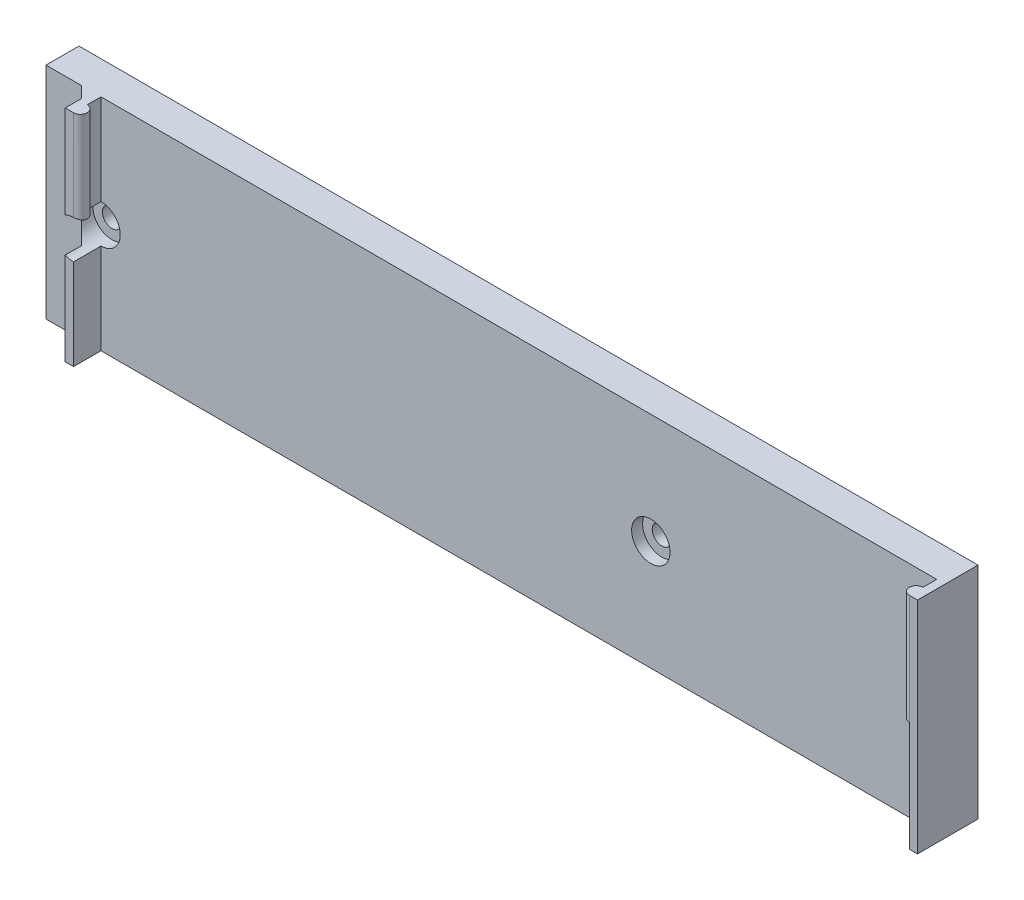
from build123d import *

# Parameters (mm, degrees)
SCHIZZO1_W                   = 155
SCHIZZO1_H                   = 70
ESTRUSIONE_ESTRUSIONE1_DEPTH = 6
ESTRUSIONE_ESTRUSIONE3_DEPTH = 5
ESTRUSIONE_ESTRUSIONE4_DEPTH = 20
SCHIZZO6_W                   = 8.5
SCHIZZO6_H                   = 70
ESTRUSIONE_ESTRUSIONE5_DEPTH = 6
SCHIZZO7_R                   = 1.75
TAGLIO_ESTRUSIONE2_DEPTH     = 94.498663092
FORO1_AT_2_COUNT             = 2
FORO1_AT_2_PITCH             = 100
SCHIZZO9_R                   = 3.5
TAGLIO_ESTRUSIONE3_DEPTH     = 94.112834821
SMUSSO1_SIZE                 = 2
TAGLIO_ESTRUSIONE4_DEPTH     = 30


with BuildPart() as part:
    # Schizzo1 → Estrusione-Estrusione1 (new body)
    with BuildSketch(Plane.XY):
        Rectangle(SCHIZZO1_W, SCHIZZO1_H)
    extrude(amount=ESTRUSIONE_ESTRUSIONE1_DEPTH)

    # Schizzo3 → Estrusione-Estrusione3 (add)
    with BuildSketch(Plane.XY.offset(6)):
        Polygon((-76, -33.5), (-76, 35), (-77.5, 35), (-77.5, -35), (-76, -35), align=None)
        Polygon((77.5, 35), (76, 35), (76, -33.5), (76, -35), (77.5, -35), align=None)
    extrude(amount=ESTRUSIONE_ESTRUSIONE3_DEPTH)

    # Schizzo4 → Estrusione-Estrusione4 (add)
    with BuildSketch(Plane(origin=(0, 35, 0), x_dir=(1, 0, 0), z_dir=(0, 1, 0))):
        with BuildLine():
            ThreePointArc((76, -8.5), (74.75, -9.75), (76, -11))
            Line((76, -11), (76, -8.5))
        make_face()
    estrusione_estrusione4 = extrude(amount=-ESTRUSIONE_ESTRUSIONE4_DEPTH)

    # Specchia1: Estrusione-Estrusione4 across plane
    add(estrusione_estrusione4.mirror(Plane(origin=(0, 0, 0), x_dir=(0, 0, 1), z_dir=(1, 0, 0))))

    # Schizzo6 → Estrusione-Estrusione5 (add)
    with BuildSketch(Plane.XY):
        with Locations((-81.75, 0)):
            Rectangle(SCHIZZO6_W, SCHIZZO6_H)
    extrude(amount=ESTRUSIONE_ESTRUSIONE5_DEPTH)

    # Schizzo7 → Taglio-Estrusione2 (cut, through all)
    with BuildSketch(Plane(origin=(0, 0, 0), x_dir=(-1, 0, 0), z_dir=(0, 0, -1))):
        with Locations((-24, 15)):
            Circle(SCHIZZO7_R)
        with Locations((76, 15)):
            Circle(SCHIZZO7_R)
    extrude(amount=-TAGLIO_ESTRUSIONE2_DEPTH, mode=Mode.SUBTRACT)

    # Schizzo8 → Foro1 (revolve, cut)
    with BuildSketch(Plane(origin=(24, 15, 6), x_dir=(0, -1, 0), z_dir=(1, 0, 0))):
        Polygon((0, 0), (0, 7.051506083), (1.75, 6), (1.75, 2), (3.5, 2), (3.5, 0), align=None)
    foro1 = revolve(axis=Axis((24, 15, 17.310875039), (0, 0, -1)), mode=Mode.SUBTRACT)

    # Foro1 at 2: Foro1 ×2
    with Locations(*[(-i * FORO1_AT_2_PITCH, 0, 0) for i in range(1, FORO1_AT_2_COUNT)]):
        add(foro1, mode=Mode.SUBTRACT)

    # Schizzo9 → Taglio-Estrusione3 (cut, through all)
    with BuildSketch(Plane.XY.offset(4)):
        with Locations((-76, 15)):
            Circle(SCHIZZO9_R)
    extrude(amount=TAGLIO_ESTRUSIONE3_DEPTH, mode=Mode.SUBTRACT)

    # Smusso1
    # the kernel refuses this chamfer: 2 mm, written as the material it adds along each edge
    with BuildSketch(Plane(origin=(-77.5, 13.018911684, 6), x_dir=(-0.9996219169112968, 0, -0.027495876610586414), z_dir=(0, 1, 0))) as smusso1_piece_1_section:
        Polygon((SMUSSO1_SIZE * 0.999621916911, SMUSSO1_SIZE * 0.0274958766106), (-SMUSSO1_SIZE * 0.0274958766106, SMUSSO1_SIZE * 0.999621916911), (0, 0), align=None)
    smusso1_piece_1 = extrude(amount=21.981088316, mode=Mode.PRIVATE)
    smusso1_piece_1 = smusso1_piece_1 - Plane(origin=(-76, 15, 6.650360418), x_dir=(0, -1, 0), z_dir=(0, 0, 1)) * Cylinder(3.5, 52, mode=Mode.PRIVATE)
    add(smusso1_piece_1)
    with BuildSketch(Plane(origin=(-77.5, -35, 6), x_dir=(0.02749587661058907, 0, 0.9996219169112965), z_dir=(0, 1, 0))) as smusso1_piece_2_section:
        Polygon((SMUSSO1_SIZE * 0.999621916911, -SMUSSO1_SIZE * 0.0274958766106), (-SMUSSO1_SIZE * 0.0274958766106, -SMUSSO1_SIZE * 0.999621916911), (0, 0), align=None)
    smusso1_piece_2 = extrude(amount=51.981088316, mode=Mode.PRIVATE)
    smusso1_piece_2 = smusso1_piece_2 - Plane(origin=(-76, 15, 6.656201353), x_dir=(1, 0, 0), z_dir=(0, 0, -1)) * Cylinder(3.5, 112, mode=Mode.PRIVATE)
    add(smusso1_piece_2)

    # Schizzo10 → Taglio-Estrusione4 (cut)
    with BuildSketch(Plane.XZ.offset(35)):
        Polygon((76, 11), (76, 6), (-76, 6), (-76, 11), (-77.5, 11), (-77.5, 8), (-79.5, 6), (-86, 6), (-86, 0), (77.5, 0), (77.5, 11), align=None)
    extrude(amount=-TAGLIO_ESTRUSIONE4_DEPTH, mode=Mode.SUBTRACT)


solid = part.part
